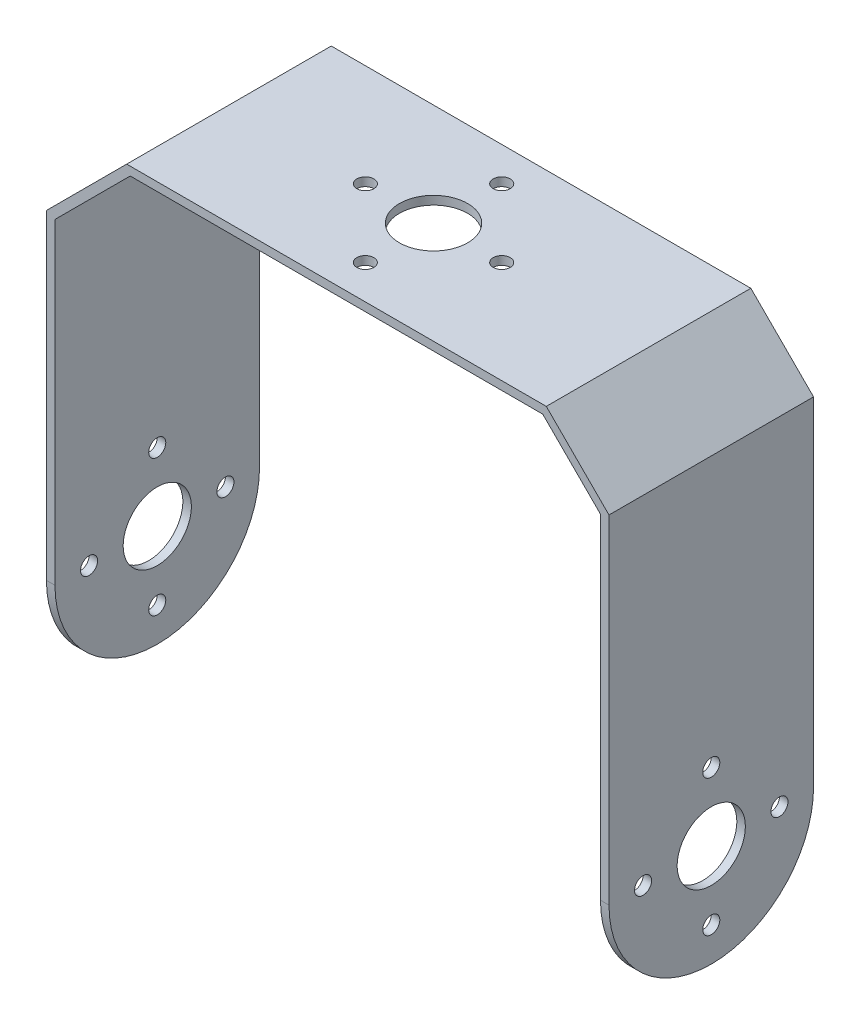
from build123d import *

# Parameters (mm, degrees)
BOSS_EXTRUDE1_DEPTH = 24
SKETCH5_R           = 1
SKETCH5_R_2         = 4
CUT_EXTRUDE3_DEPTH  = 1
CUT_EXTRUDE4_START  = -1
SKETCH6_R           = 4
SKETCH6_R_2         = 1
CUT_EXTRUDE4_DEPTH  = 1
SKETCH7_R           = 4
SKETCH7_R_2         = 1
CUT_EXTRUDE5_DEPTH  = 1
FILLET1_R           = 12


with BuildPart() as part:
    # Sketch1 → Boss-Extrude1 (new body)
    with BuildSketch(Plane.XY):
        Polygon((18.706612688, 0.24678935), (18.706612688, -50.981637775), (19.706612688, -50.981637775), (19.706612688, 0.661002912), (12.349253376, 8.018362225), (-36.879173749, 8.018362225), (-46.293387312, -1.395851338), (-46.293387312, -50.981637775), (-45.293387312, -50.981637775), (-45.293387312, -1.8100649), (-36.464960187, 7.018362225), (11.935039813, 7.018362225), align=None)
    extrude(amount=BOSS_EXTRUDE1_DEPTH)

    # Sketch5 → Cut-Extrude3 (cut)
    with BuildSketch(Plane.ZY.offset(46.293387312)):
        with Locations((20, -38.981637775)):
            Circle(SKETCH5_R)
        with Locations((12, -38.981637775)):
            Circle(SKETCH5_R_2)
        with Locations((12, -46.981637775)):
            Circle(SKETCH5_R)
        with Locations((4, -38.981637775)):
            Circle(SKETCH5_R)
        with Locations((12, -30.981637775)):
            Circle(SKETCH5_R)
    extrude(amount=-CUT_EXTRUDE3_DEPTH, mode=Mode.SUBTRACT)

    # Sketch6 → Cut-Extrude4 (cut)
    with BuildSketch(Plane(origin=(19.706612688, 0, 0), x_dir=(0, 0, -1), z_dir=(1, 0, 0)).offset(CUT_EXTRUDE4_START)):
        with Locations(Location((-12, -38.981637775, 0), (0, 0, 180))):
            Circle(SKETCH6_R)
        with Locations(Location((-4, -38.981637775, 0), (0, 0, 180))):
            Circle(SKETCH6_R_2)
        with Locations(Location((-12, -46.981637775, 0), (0, 0, 180))):
            Circle(SKETCH6_R_2)
        with Locations(Location((-20, -38.981637775, 0), (0, 0, 180))):
            Circle(SKETCH6_R_2)
        with Locations(Location((-12, -30.981637775, 0), (0, 0, 180))):
            Circle(SKETCH6_R_2)
    extrude(amount=CUT_EXTRUDE4_DEPTH, mode=Mode.SUBTRACT)

    # Sketch7 → Cut-Extrude5 (cut)
    with BuildSketch(Plane(origin=(0, 8.018362225, 0), x_dir=(1, 0, 0), z_dir=(0, 1, 0))):
        with Locations(Location((-12.879173749, -12, 0), (0, 0, 180))):
            Circle(SKETCH7_R)
        with Locations(Location((-12.879173749, -20, 0), (0, 0, 180))):
            Circle(SKETCH7_R_2)
        with Locations(Location((-20.879173749, -12, 0), (0, 0, 180))):
            Circle(SKETCH7_R_2)
        with Locations(Location((-12.879173749, -4, 0), (0, 0, 180))):
            Circle(SKETCH7_R_2)
        with Locations(Location((-4.879173749, -12, 0), (0, 0, 180))):
            Circle(SKETCH7_R_2)
    extrude(amount=-CUT_EXTRUDE5_DEPTH, mode=Mode.SUBTRACT)

    # Fillet1
    fillet1_edges = [part.edges().sort_by_distance(p)[0] for p in [
        (19.206612688, -50.981637775, 24),
        (19.206612688, -50.981637775, 0),
        (-45.793387312, -50.981637775, 24),
        (-45.793387312, -50.981637775, 0),
    ]]
    fillet(fillet1_edges, radius=FILLET1_R - 0.0001)  # a hair under: the kernel refuses the full size


solid = part.part
